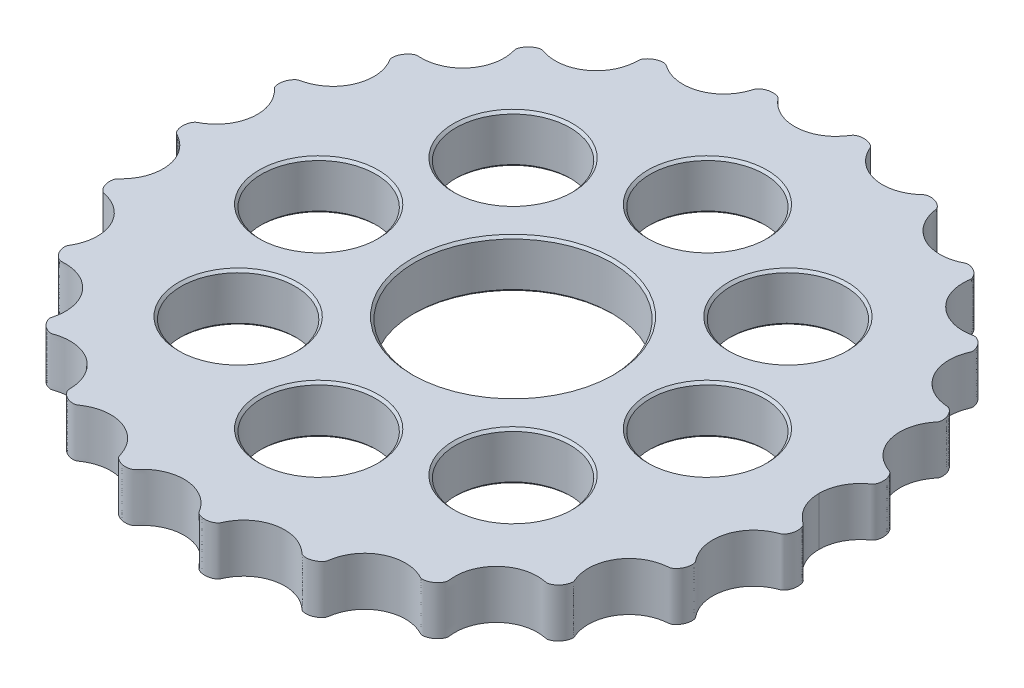
from build123d import *

# Parameters (mm, degrees)
BOSS_EXTRUDE2_DEPTH          = 4
SKETCH4_R                    = 8.1
CUT_EXTRUDE3_DEPTH           = 39.631779925
CHAMFER3_SIZE                = 0.2
SKETCH5_R                    = 4.7
CUT_EXTRUDE4_DEPTH           = 39.631779925
CHAMFER4_SIZE                = 0.2
CIRPATTERN2_COUNT            = 8
CHAMFER4_OF_CIRPATTERN2_SIZE = 0.2


with BuildPart() as part:
    # Boss-Extrude2: read off the stored shape, not the designer's step
    # Boss-Extrude2 outline → Boss-Extrude2 (new body)
    with BuildSketch(Plane(origin=(0, 0, 0), x_dir=(1, 0, 0), z_dir=(0, 1, 0))):
        with BuildLine():
            add(Edge.make_bspline(
                [(-27.2, -5.8e-08), (-27.199999999, -0.019133198), (-27.199133078, -0.057414725), (-27.195230703, -0.135465489), (-27.184807139, -0.211606055), (-27.166047725, -0.317535919), (-27.1349332, -0.429637697), (-27.091322319, -0.544583371), (-27.033663095, -0.652443367), (-26.975857569, -0.733258599), (-26.924878158, -0.790098396), (-26.85236248, -0.828146861), (-26.765832876, -0.877662664), (-26.653610001, -0.940819982), (-26.520769432, -1.023294126), (-26.379460109, -1.118575559), (-26.243541467, -1.220153984), (-26.112815998, -1.327504856), (-25.956815793, -1.468850425), (-25.779030612, -1.652001201), (-25.588219714, -1.884370565), (-25.39581381, -2.174101422), (-25.232178371, -2.486707055), (-25.077886955, -2.876099546), (-24.958985718, -3.349713644), (-24.910568474, -3.899287927), (-24.961634909, -4.436621669), (-25.07457138, -4.884978252), (-25.210781376, -5.239398914), (-25.3276905, -5.47778769), (-25.441338131, -5.672119707), (-25.543827079, -5.827030815), (-25.631803755, -5.947926268), (-25.724673074, -6.066389993), (-25.823842053, -6.180410635), (-25.910396853, -6.276707585), (-25.987352438, -6.351151536), (-26.044490633, -6.415067749), (-26.092464449, -6.45600624), (-26.148149594, -6.514552868), (-26.194742233, -6.621546796), (-26.230737515, -6.753942005), (-26.246736581, -6.913621726), (-26.241123125, -7.116681647), (-26.200480651, -7.341945139), (-26.124592781, -7.549062612), (-26.018035516, -7.731798337), (-25.908629577, -7.868961888), (-25.83151017, -7.942653437), (-25.763973317, -7.994708314), (-25.707824804, -8.022972123), (-25.679470972, -8.031842631), (-25.639908355, -8.041546861), (-25.589515371, -8.052677101), (-25.511041609, -8.072589283), (-25.404063123, -8.099565023), (-25.280287279, -8.134973629), (-25.104529367, -8.191921939), (-24.89680419, -8.271617077), (-24.660435134, -8.381527642), (-24.40130618, -8.530284177), (-24.154075981, -8.702420835), (-23.921178729, -8.897438935), (-23.648160332, -9.171461595), (-23.357579614, -9.545571582), (-23.086909105, -10.037086429), (-22.890864249, -10.644457773), (-22.822171233, -11.200115629), (-22.83820931, -11.677409754), (-22.899462682, -12.065810534), (-22.978110571, -12.37473042), (-23.068277813, -12.629470629), (-23.156573516, -12.832643057), (-23.233562226, -12.988559431), (-23.285354738, -13.086212132), (-23.32769556, -13.162049812), (-23.358689891, -13.217069346), (-23.381507202, -13.258136052), (-23.406670608, -13.29804194), (-23.425113283, -13.357547237), (-23.433717747, -13.434580828), (-23.436059793, -13.53454811), (-23.423191253, -13.657405355), (-23.384676738, -13.83270161), (-23.297377573, -14.052902726), (-23.173479148, -14.250202012), (-23.018849262, -14.419355844), (-22.882423501, -14.527841296), (-22.779755067, -14.593323155), (-22.687416154, -14.634714297), (-22.608621564, -14.663240416), (-22.532336694, -14.66186154), (-22.464064965, -14.657970826), (-22.391580535, -14.656086169), (-22.315385272, -14.654138828), (-22.220165909, -14.653477794), (-22.105845044, -14.655165733), (-21.933543936, -14.663343042), (-21.703951418, -14.68683955), (-21.436771712, -14.733876274), (-21.13585441, -14.815135911), (-20.840455355, -14.924655078), (-20.553491659, -15.062675785), (-20.207755347, -15.271289639), (-19.829605953, -15.571759834), (-19.451690105, -15.985580336), (-19.121972629, -16.522488437), (-18.927668303, -17.027839181), (-18.829211055, -17.476164511), (-18.791991341, -17.853504646), (-18.788981921, -18.159998252), (-18.809262438, -18.419503174), (-18.84014115, -18.631196598), (-18.871792288, -18.794093532), (-18.893707642, -18.894966449), (-18.915505759, -18.980874841), (-18.931075876, -19.051982982), (-18.947901611, -19.107372763), (-18.954062875, -19.170820488), (-18.943078235, -19.240288438), (-18.924025051, -19.327408787), (-18.886701234, -19.430785272), (-18.815263952, -19.579961077), (-18.689011452, -19.763062789), (-18.529546377, -19.924564281), (-18.340630276, -20.057517125), (-18.182290152, -20.136177379), (-18.066460518, -20.178399905), (-17.968536727, -20.202644418), (-17.898795619, -20.212549096), (-17.84364737, -20.2156627), (-17.793454162, -20.213145524), (-17.743136497, -20.197210151), (-17.683681642, -20.177756445), (-17.61388666, -20.156085997), (-17.525786876, -20.128528284), (-17.418286307, -20.0980991), (-17.254892846, -20.056404914), (-16.95501287, -19.996611201), (-16.538675557, -19.955693958), (-16.00112496, -19.98218915), (-15.396099339, -20.123997765), (-14.812677592, -20.380133792), (-14.341437934, -20.706758581), (-13.981827655, -21.055991598), (-13.719839104, -21.390245599), (-13.53979047, -21.674527031), (-13.390289283, -21.971915381), (-13.286238799, -22.240809426), (-13.215891125, -22.476885141), (-13.169996904, -22.675012707), (-13.140874334, -22.833699578), (-13.118703006, -22.992379392), (-13.103635019, -23.150773266), (-13.095546098, -23.282189417), (-13.092493945, -23.386532965), (-13.089038065, -23.463253212), (-13.090424315, -23.513243694), (-13.074934477, -23.586740215), (-13.031117566, -23.677875366), (-12.963825271, -23.783935666), (-12.86119124, -23.900988328), (-12.742986195, -24.007310293), (-12.579895325, -24.121520152), (-12.402576926, -24.209890577), (-12.218984696, -24.269871728), (-12.048498563, -24.298215568), (-11.932124337, -24.304382185), (-11.836331176, -24.300138385), (-11.763415144, -24.288312725), (-11.687027062, -24.271319803), (-11.620988181, -24.224386523), (-11.547155689, -24.176866601), (-11.465099614, -24.122999491), (-11.370591212, -24.06474547), (-11.262550044, -24.001451539), (-11.106804169, -23.917556005), (-10.898188883, -23.819353065), (-10.645807902, -23.722189622), (-10.276844798, -23.616758409), (-9.816309632, -23.543086726), (-9.267413402, -23.539828019), (-8.635295247, -23.654647544), (-8.099049848, -23.86471981), (-7.66886369, -24.121482982), (-7.337822569, -24.385263094), (-7.09806284, -24.61883599), (-6.884838068, -24.871745046), (-6.69901355, -25.14068068), (-6.561679291, -25.385644979), (-6.462454566, -25.598293012), (-6.391492149, -25.774528342), (-6.348447481, -25.894329935), (-6.313848449, -25.99770764), (-6.289717996, -26.075594837), (-6.272760698, -26.126541704), (-6.258863328, -26.178235229), (-6.224719265, -26.242456394), (-6.156688332, -26.318820815), (-6.059008395, -26.404882396), (-5.893718118, -26.511209554), (-5.675048028, -26.606079822), (-5.4418816, -26.658092325), (-5.205010451, -26.666553872), (-5.030920697, -26.645219452), (-4.91654205, -26.618244261), (-4.825889434, -26.585936626), (-4.758596326, -26.554076886), (-4.701310073, -26.518631026), (-4.66388201, -26.472615776), (-4.617247571, -26.419913995), (-4.563156132, -26.35736677), (-4.49881391, -26.285734931), (-4.415356267, -26.19688573), (-4.320872504, -26.10241462), (-4.185555254, -25.976712199), (-4.003412827, -25.826060224), (-3.777904261, -25.666242736), (-3.438718175, -25.469797984), (-3.00025539, -25.283030726), (-2.456697225, -25.1464052), (-1.811217889, -25.109882833), (-1.163691188, -25.199409324), (-0.624802578, -25.384578627), (-0.196649277, -25.613669517), (0.127465909, -25.843399722), (0.365025453, -26.046782245), (0.552943314, -26.239326417), (0.698532344, -26.411243752), (0.809429266, -26.556968603), (0.880797006, -26.657723218), (0.939693298, -26.745579213), (0.983018656, -26.811854011), (1.011889922, -26.85557123), (1.0395542, -26.900013631), (1.078345264, -26.94055319), (1.135568041, -26.979658579), (1.219592815, -27.02789574), (1.327974533, -27.072692378), (1.496010267, -27.121750548), (1.728424506, -27.150236986), (1.962611636, -27.136101197), (2.190194928, -27.079585301), (2.351969604, -27.010876659), (2.454840066, -26.953007153), (2.533688841, -26.895900708), (2.584895449, -26.850372233), (2.62171053, -26.808968546), (2.64524478, -26.76452663), (2.665782902, -26.718378658), (2.699039113, -26.65033022), (2.742433701, -26.558724873), (2.796394926, -26.453597394), (2.883533195, -26.295151603), (3.002933339, -26.102488482), (3.162909413, -25.881029118), (3.372982259, -25.640178522), (3.659114137, -25.36796782), (4.044711701, -25.082682583), (4.543417912, -24.823347956), (5.160557484, -24.639572546), (5.804190402, -24.577228491), (6.361235413, -24.629618796), (6.820197055, -24.7468534), (7.180218364, -24.887232731), (7.452476185, -25.022228636), (7.674347709, -25.157295039), (7.850535459, -25.281419164), (7.986991801, -25.387855166), (8.075084157, -25.460712515), (8.148905246, -25.52525041), (8.204458647, -25.572814945), (8.2402695, -25.605775958), (8.278382908, -25.635134892), (8.327055973, -25.657418062), (8.390484742, -25.678350459), (8.483570505, -25.699076769), (8.599095622, -25.711408859), (8.771449182, -25.710805412), (9.00232799, -25.673785619), (9.223302976, -25.59486344), (9.426876478, -25.477031327), (9.564958464, -25.36298995), (9.649372937, -25.276716289), (9.70701868, -25.1981895), (9.748697398, -25.133843502), (9.768430295, -25.066120088), (9.775777307, -25.001315327), (9.792835497, -24.918095823), (9.809245242, -24.813749212), (9.835501529, -24.693642827), (9.878848292, -24.51143358), (9.946347693, -24.287270871), (10.046444237, -24.024378406), (10.19206868, -23.729991019), (10.406692405, -23.383605305), (10.719642961, -22.998615805), (11.154332181, -22.613406477), (11.724097328, -22.280768853), (12.268835026, -22.093053323), (12.744642468, -22.010498453), (13.137075936, -21.992087242), (13.445028475, -22.005696268), (13.747746711, -22.046557228), (14.006316982, -22.104694797), (14.223188655, -22.170215357), (14.390065703, -22.230335278), (14.509885677, -22.279037925), (14.618582787, -22.325532416), (14.716359705, -22.372679206), (14.803173962, -22.411561304), (14.878382664, -22.452760952), (14.95968466, -22.460471913), (15.036057996, -22.462109616), (15.135875894, -22.452772264), (15.256436488, -22.428517485), (15.425109993, -22.37394062), (15.632106425, -22.269768199), (15.814129425, -22.132636958), (15.965931182, -21.969333295), (16.059115396, -21.831474223), (16.111365519, -21.733844424), (16.14383144, -21.650409895), (16.163682031, -21.58425453), (16.170950954, -21.521351267), (16.161688435, -21.464159075), (16.155860088, -21.389076426), (16.145038284, -21.295424212), (16.136692107, -21.186115641), (16.127498168, -21.017536268), (16.126269084, -20.80526027), (16.141510864, -20.548473986), (16.185318357, -20.249577003), (16.255883937, -19.952429431), (16.354008813, -19.659668157), (16.512399064, -19.299966466), (16.754655955, -18.895634421), (17.107232223, -18.473068057), (17.588260553, -18.076850807), (18.059925697, -17.815170005), (18.492639869, -17.654850785), (18.861232174, -17.566562604), (19.123599394, -17.527952619), (19.348018577, -17.511424217), (19.533651718, -17.508184382), (19.683012998, -17.511857017), (19.832842468, -17.521605481), (19.982859323, -17.537526577), (20.106884249, -17.554993484), (20.205088076, -17.571626575), (20.278033953, -17.584026137), (20.325615032, -17.592332845), (20.371290172, -17.601212733), (20.415459767, -17.599877742), (20.466730737, -17.59076029), (20.534155398, -17.573715385), (20.618294528, -17.542661823), (20.723767019, -17.490758414), (20.838111044, -17.417571118), (20.979828886, -17.303526123), (21.109507981, -17.163723096), (21.218157865, -17.007247314), (21.298783601, -16.845400046), (21.344353419, -16.720719826), (21.372673835, -16.609254476), (21.385074169, -16.513807755), (21.388802808, -16.429060026), (21.378097961, -16.35695084), (21.346028453, -16.292682934), (21.324477519, -16.227447162), (21.289690418, -16.144823584), (21.252680096, -16.042010872), (21.211276942, -15.921226904), (21.158712582, -15.744380248), (21.106242449, -15.527406409), (21.062847691, -15.269403782), (21.038730924, -14.970461144), (21.041419009, -14.591737623), (21.099514779, -14.133182412), (21.249130997, -13.610610307), (21.528443052, -13.052208973), (21.903282747, -12.558539383), (22.300819587, -12.196099867), (22.745297615, -11.8993405), (23.157019367, -11.705191301), (23.4800956, -11.597229767), (23.771423328, -11.5307645), (23.933059675, -11.502466075), (24.037729575, -11.487462758), (24.125096623, -11.476082347), (24.195306497, -11.469412342), (24.260843892, -11.461701639), (24.321910644, -11.456216455), (24.387015964, -11.449232346), (24.449668291, -11.419362265), (24.52302427, -11.376799829), (24.604172718, -11.314759519), (24.718572535, -11.207868672), (24.850036792, -11.040948052), (24.954704179, -10.846246939), (25.02610642, -10.628861387), (25.056825067, -10.450622479), (25.06465956, -10.317676292), (25.059036844, -10.204871957), (25.043965515, -10.113836967), (25.025248118, -10.04463421), (25.004912469, -9.99802351), (24.976064244, -9.959056605), (24.938238258, -9.910582847), (24.895170115, -9.852676713), (24.845066465, -9.786345637), (24.784234874, -9.701138925), (24.721590619, -9.609512939), (24.651926212, -9.500340335), (24.557345086, -9.338410822), (24.453849457, -9.13621637), (24.321673023, -8.824386079), (24.19360824, -8.386114996), (24.120926778, -7.852419469), (24.150120672, -7.225330595), (24.300722879, -6.597919091), (24.571250126, -6.006926265), (24.906002732, -5.541138338), (25.250263613, -5.195203354), (25.565693114, -4.948936314), (25.801983018, -4.797384567), (26.011688287, -4.683777206), (26.173073138, -4.60767808), (26.284218182, -4.559219437), (26.380146848, -4.521095335), (26.448944327, -4.491508361), (26.509506384, -4.471271375), (26.579578657, -4.440383108), (26.640996169, -4.384242444), (26.70672435, -4.310831751), (26.801461685, -4.170405785), (26.893463025, -3.973793652), (26.950808441, -3.749748192), (26.966774836, -3.507070545), (26.949648435, -3.317402376), (26.921678715, -3.18241347), (26.885878155, -3.073525585), (26.848407268, -2.990285719), (26.812121046, -2.928551983), (26.780884093, -2.886598489), (26.740177345, -2.853320754), (26.697457873, -2.82223908), (26.648413979, -2.785010881), (26.576072871, -2.729479125), (26.488328946, -2.660050157), (26.386835419, -2.574575111), (26.273360152, -2.471280002), (26.163378128, -2.362477632), (26.057289551, -2.24796738), (25.955568553, -2.128066416), (25.858626822, -2.002301231), (25.701843205, -1.779060884), (25.565451422, -1.540480889), (25.451334792, -1.291744247), (25.360817709, -1.031127703), (25.31516078, -0.879403726), (25.276834441, -0.718665774), (25.245978754, -0.568295348), (25.222714357, -0.395119689), (25.207145033, -0.256635565), (25.201299171, -0.107230742), (25.200000036, -0.035922583), (25.2, -3.334e-06)],
                knots=[0.046454864, 0.046454864, 0.046454864, 0.046454864, 0.046454864, 0.047232469, 0.048010073, 0.048787678, 0.049565282, 0.050938566, 0.05231185, 0.05315329, 0.053994729, 0.054515303, 0.055035878, 0.056077026, 0.057614054, 0.059151082, 0.060688109, 0.062225137, 0.063740528, 0.065255919, 0.068286701, 0.071433014, 0.074579326, 0.077791817, 0.081004308, 0.086528383, 0.092148952, 0.097600605, 0.100385791, 0.103170977, 0.105840314, 0.107174982, 0.10850965, 0.109874755, 0.11123986, 0.112604965, 0.11397007, 0.114541538, 0.115113005, 0.115684473, 0.11625594, 0.117421822, 0.11927225, 0.120640687, 0.122009125, 0.124752137, 0.127492464, 0.12855148, 0.129610496, 0.131071512, 0.131339425, 0.131607339, 0.131875252, 0.132143166, 0.132807096, 0.133471025, 0.134798885, 0.136126745, 0.137454604, 0.140140904, 0.142827204, 0.145528371, 0.148229538, 0.151005085, 0.153780633, 0.159476507, 0.165276509, 0.171144386, 0.176683858, 0.179574119, 0.18246438, 0.185321259, 0.188178138, 0.189318444, 0.19045875, 0.191599057, 0.19216921, 0.192454287, 0.192739363, 0.193297943, 0.193856523, 0.194689634, 0.195522744, 0.19691039, 0.198298035, 0.20116106, 0.204021251, 0.205269796, 0.206518341, 0.207453746, 0.208389152, 0.20894087, 0.209492588, 0.210180452, 0.210868316, 0.21155618, 0.212244045, 0.213619773, 0.214995501, 0.217783514, 0.220571528, 0.223403098, 0.226234669, 0.229143498, 0.232052327, 0.23796145, 0.243610948, 0.249256343, 0.254671638, 0.257403099, 0.260134561, 0.262929671, 0.26572478, 0.266790025, 0.26785527, 0.268920515, 0.269453137, 0.269985759, 0.270490915, 0.270996071, 0.271746348, 0.272496624, 0.27372076, 0.274944896, 0.277712789, 0.28048076, 0.281861751, 0.283242742, 0.28408284, 0.284922937, 0.285497224, 0.285784367, 0.28607151, 0.286730628, 0.287389746, 0.288048864, 0.288707982, 0.290065233, 0.291422485, 0.294136988, 0.299742208, 0.305126441, 0.310752266, 0.316453804, 0.322615531, 0.325697654, 0.328779776, 0.331762651, 0.334745525, 0.337697862, 0.33917403, 0.340650198, 0.34208599, 0.343521782, 0.344957575, 0.346393367, 0.34684075, 0.347288133, 0.347735516, 0.3481829, 0.349540401, 0.350905748, 0.352271095, 0.353773536, 0.355275978, 0.35807282, 0.359393936, 0.360715051, 0.361497571, 0.362280092, 0.362838678, 0.363397265, 0.364278124, 0.365158983, 0.366039841, 0.3669207, 0.368297581, 0.369674462, 0.372428225, 0.375239429, 0.378050634, 0.383511041, 0.389216454, 0.394947945, 0.401111676, 0.404172852, 0.407234029, 0.410206124, 0.41317822, 0.416098901, 0.419019582, 0.420332349, 0.421645117, 0.422957885, 0.423614269, 0.424270653, 0.424586257, 0.424901862, 0.425533072, 0.426883808, 0.428243238, 0.429602668, 0.432595813, 0.435453384, 0.436789163, 0.438124941, 0.43890833, 0.439691719, 0.440253953, 0.440816186, 0.441313139, 0.441810092, 0.442803998, 0.443797904, 0.444791809, 0.446210021, 0.447628233, 0.450464657, 0.4533206, 0.456176544, 0.461761291, 0.467617147, 0.473438391, 0.479376925, 0.485216446, 0.488063509, 0.490910571, 0.493701665, 0.496492758, 0.497766155, 0.499039552, 0.500312949, 0.500949648, 0.501586346, 0.50189722, 0.502208094, 0.502829841, 0.503604268, 0.504378695, 0.505712099, 0.507045503, 0.509915607, 0.512782554, 0.514123557, 0.51546456, 0.516248863, 0.517033167, 0.517634076, 0.517934531, 0.518234986, 0.518844574, 0.519454162, 0.520673337, 0.521892513, 0.523111689, 0.525982103, 0.528852518, 0.531743848, 0.534635178, 0.540221342, 0.546114964, 0.551919501, 0.557741901, 0.563427302, 0.566197215, 0.568967128, 0.571676508, 0.574385887, 0.575565318, 0.576744749, 0.57792418, 0.578513896, 0.579103611, 0.579389859, 0.579676106, 0.580248601, 0.581023253, 0.581797906, 0.583115079, 0.584432252, 0.58723539, 0.590192252, 0.591530449, 0.592868646, 0.593696604, 0.594524561, 0.595061397, 0.595598234, 0.596232646, 0.596867058, 0.598135881, 0.599404705, 0.600673529, 0.603628091, 0.606582653, 0.609548325, 0.612513997, 0.618319571, 0.62443328, 0.630386103, 0.636179067, 0.638994433, 0.641809799, 0.644551946, 0.647294092, 0.650009901, 0.651367806, 0.65272571, 0.653699775, 0.65467384, 0.655647906, 0.656621971, 0.657168634, 0.657715297, 0.658553639, 0.65939198, 0.660772137, 0.662152294, 0.664935947, 0.66771994, 0.668940792, 0.670161643, 0.670933623, 0.671705603, 0.672174044, 0.672642485, 0.673208384, 0.673774283, 0.67490608, 0.676037878, 0.677169675, 0.679868508, 0.68256734, 0.685315467, 0.688063594, 0.690882188, 0.693700781, 0.699487072, 0.705024207, 0.710638272, 0.716076702, 0.718855775, 0.721634848, 0.72430507, 0.725640181, 0.726975292, 0.728336867, 0.729698441, 0.731060016, 0.73242159, 0.732858304, 0.733295019, 0.733731733, 0.734168447, 0.734527276, 0.734886104, 0.735603762, 0.736679875, 0.737755988, 0.739124732, 0.740493476, 0.743236832, 0.744607226, 0.745977619, 0.747002686, 0.748027753, 0.748742486, 0.749457219, 0.750047935, 0.750638651, 0.751296931, 0.751955211, 0.753271771, 0.754588331, 0.755904891, 0.758615856, 0.76132682, 0.764023677, 0.766720534, 0.772273833, 0.777963976, 0.78353911, 0.789135136, 0.794529173, 0.797282477, 0.802778105, 0.805520427, 0.806793032, 0.808065636, 0.808701938, 0.809338241, 0.809974543, 0.810610845, 0.811084403, 0.811557961, 0.812319576, 0.81308119, 0.814155534, 0.815229878, 0.817967101, 0.820711296, 0.822082278, 0.823453259, 0.824482807, 0.825512355, 0.826148014, 0.826783673, 0.827060971, 0.827338269, 0.827892864, 0.829002055, 0.829669931, 0.830337807, 0.831673558, 0.83300931, 0.834345061, 0.837107327, 0.839869593, 0.845222841, 0.850783138, 0.856452013, 0.862408244, 0.868377936, 0.874101439, 0.877036047, 0.879970655, 0.882806118, 0.884223849, 0.88564158, 0.886412194, 0.887182807, 0.887953421, 0.888338728, 0.888724035, 0.88992562, 0.890915013, 0.891904406, 0.894816656, 0.897729019, 0.899188273, 0.900647527, 0.901672688, 0.90269785, 0.903317668, 0.903937486, 0.904255322, 0.904573157, 0.905208828, 0.905844498, 0.906480169, 0.907864894, 0.909249618, 0.910634343, 0.912019068, 0.913450591, 0.914882113, 0.916313636, 0.917745158, 0.923308634, 0.924758084, 0.926207534, 0.927656985, 0.929106435, 0.930566256, 0.932026077, 0.933485899, 0.934945754, 0.934945754, 0.934945754, 0.934945754, 0.934945754], degree=4))
            add(Edge.make_bspline(
                [(25.2, -3.334e-06), (25.200000038, 0.035919249), (25.201299178, 0.107227408), (25.207145049, 0.256632231), (25.222714382, 0.395116354), (25.245978789, 0.568292011), (25.276834486, 0.718662435), (25.315160835, 0.879400385), (25.360817773, 1.031124359), (25.451334873, 1.291740897), (25.565451518, 1.540477532), (25.701843316, 1.779057519), (25.858626947, 2.002297856), (25.955568686, 2.128063035), (26.057289691, 2.247963993), (26.163378276, 2.362474238), (26.273360306, 2.471276601), (26.38683558, 2.574571703), (26.488329112, 2.660046743), (26.576073042, 2.729475705), (26.648414153, 2.785007456), (26.697458049, 2.822235652), (26.740177523, 2.853317324), (26.780884273, 2.886595057), (26.812121229, 2.928548548), (26.848407455, 2.990282282), (26.885878347, 3.073522146), (26.921678914, 3.182410028), (26.949648643, 3.317398933), (26.966775055, 3.5070671), (26.950808676, 3.749744748), (26.893463274, 3.973790212), (26.801461946, 4.170402351), (26.70672462, 4.310828323), (26.640996443, 4.38423902), (26.579578934, 4.440379688), (26.509506664, 4.471267959), (26.448944608, 4.491504949), (26.380147131, 4.521091927), (26.284218467, 4.559216035), (26.173073426, 4.607674685), (26.01168858, 4.683773821), (25.801983318, 4.797381196), (25.565693424, 4.948932957), (25.250263938, 5.195200017), (24.906003078, 5.541135022), (24.571250502, 6.00692297), (24.300723291, 6.597915813), (24.150121123, 7.225327327), (24.120927269, 7.852416202), (24.193608765, 8.386111725), (24.321673575, 8.8243828), (24.453850028, 9.136213082), (24.55734567, 9.338407528), (24.651926806, 9.500337035), (24.72159122, 9.609509635), (24.78423548, 9.701135617), (24.845067077, 9.786342325), (24.895170731, 9.852673398), (24.938238878, 9.910579529), (24.976064866, 9.959053285), (25.004913094, 9.998020188), (25.025248746, 10.044630887), (25.043966147, 10.113833643), (25.059037481, 10.204868632), (25.064660205, 10.317672967), (25.05682572, 10.450619154), (25.026107085, 10.628858064), (24.954704857, 10.84624362), (24.850037483, 11.04094474), (24.718573236, 11.207865368), (24.604173426, 11.314756222), (24.523024981, 11.376796537), (24.449669005, 11.419358978), (24.38701668, 11.449229063), (24.32191136, 11.456213176), (24.260844609, 11.461698364), (24.195307214, 11.469409071), (24.12509734, 11.47607908), (24.037730293, 11.487459497), (23.933060394, 11.50246282), (23.771424049, 11.530761255), (23.480096325, 11.59722654), (23.157020099, 11.705188094), (22.745298359, 11.89933732), (22.30082035, 12.196096715), (21.903283532, 12.558536255), (21.528443868, 13.052205869), (21.249131848, 13.61060722), (21.099515662, 14.133179335), (21.041419921, 14.591734549), (21.03873186, 14.97045807), (21.062848646, 15.269400707), (21.10624342, 15.527403331), (21.158713566, 15.744377167), (21.211277938, 15.921223819), (21.252681099, 16.042007785), (21.289691428, 16.144820495), (21.324478534, 16.22744407), (21.346029471, 16.292679841), (21.378098984, 16.356947745), (21.388803835, 16.429056931), (21.385075202, 16.51380466), (21.372674873, 16.609251381), (21.344354465, 16.720716733), (21.298784654, 16.845396956), (21.218158929, 17.007244229), (21.109509054, 17.163720018), (20.979829968, 17.303523053), (20.838112133, 17.417568057), (20.723768112, 17.49075536), (20.618295625, 17.542658776), (20.534156497, 17.573712343), (20.466731837, 17.590757252), (20.415460867, 17.599874707), (20.371291273, 17.601209701), (20.325616132, 17.592329816), (20.278035053, 17.584023111), (20.205089174, 17.571623553), (20.106885347, 17.554990468), (19.98286042, 17.537523569), (19.832843563, 17.521602482), (19.683014092, 17.511854027), (19.533652812, 17.508181402), (19.348019672, 17.511421249), (19.123600489, 17.527949665), (18.861233272, 17.566559666), (18.492640973, 17.65484787), (18.05992681, 17.815167118), (17.588261683, 18.076847949), (17.107233378, 18.473065229), (16.754657137, 18.895631615), (16.51240027, 19.299963675), (16.354010042, 19.659665376), (16.255885184, 19.952426656), (16.185319623, 20.249574232), (16.141512148, 20.548471219), (16.126270385, 20.805257503), (16.127499482, 21.017533501), (16.136693432, 21.186112873), (16.145039616, 21.295421444), (16.155861425, 21.389073657), (16.161689777, 21.464156306), (16.170952299, 21.521348497), (16.16368338, 21.584251761), (16.143832794, 21.650407127), (16.111366878, 21.733841658), (16.059116761, 21.83147146), (15.965932556, 21.969330538), (15.814130809, 22.132634211), (15.632107817, 22.269765463), (15.425111392, 22.373937897), (15.256437891, 22.428514772), (15.135877297, 22.452769559), (15.036059401, 22.462106918), (14.959686065, 22.460469219), (14.878384067, 22.452758263), (14.803175363, 22.41155862), (14.716361104, 22.372676527), (14.618584182, 22.325529744), (14.50988707, 22.27903526), (14.390067093, 22.23033262), (14.223190041, 22.170212709), (14.006318364, 22.104692162), (13.74774809, 22.04655461), (13.445029851, 22.005693669), (13.137077311, 21.992084662), (12.744643844, 22.010495898), (12.268836407, 22.093050797), (11.724098721, 22.280766361), (11.154333595, 22.613404021), (10.719644399, 22.998613376), (10.406693867, 23.383602896), (10.192070164, 23.729988623), (10.046445739, 24.024376019), (9.946349211, 24.287268491), (9.878849825, 24.511431204), (9.835503073, 24.693640453), (9.809246793, 24.813746841), (9.792837055, 24.918093453), (9.77577887, 25.001312957), (9.768431862, 25.066117719), (9.748698969, 25.133841134), (9.707020255, 25.198187135), (9.649374517, 25.276713927), (9.564960049, 25.362987594), (9.426878071, 25.47702898), (9.223304576, 25.594861105), (9.002329595, 25.673783298), (8.77145079, 25.710803105), (8.599097229, 25.711406563), (8.483572112, 25.69907448), (8.390486348, 25.678348176), (8.327057577, 25.657415783), (8.278384511, 25.635132616), (8.240271101, 25.605773684), (8.204460246, 25.572812674), (8.148906842, 25.525248142), (8.075085749, 25.460710252), (7.986993389, 25.387852908), (7.85053704, 25.281416915), (7.674349281, 25.157292801), (7.45247775, 25.022226411), (7.18021992, 24.887230523), (6.820198602, 24.746851215), (6.361236953, 24.629616639), (5.804191939, 24.577226369), (5.160559024, 24.639570465), (4.543419464, 24.823345913), (4.044713269, 25.082680571), (3.659115723, 25.367965833), (3.372983862, 25.640176552), (3.162911031, 25.881027162), (3.002934971, 26.102486536), (2.883534839, 26.295149664), (2.79639658, 26.45359546), (2.742435361, 26.558722943), (2.69904078, 26.650328293), (2.665784572, 26.718376733), (2.645246454, 26.764524706), (2.621712207, 26.808966624), (2.584897127, 26.850370313), (2.533690523, 26.895898791), (2.454841751, 26.953005241), (2.351971293, 27.010874753), (2.190196621, 27.079583406), (1.962613332, 27.136099316), (1.728426204, 27.150235119), (1.496011963, 27.121748696), (1.327976225, 27.072690536), (1.219594504, 27.027893906), (1.135569728, 26.97965675), (1.078346948, 26.940551364), (1.039555882, 26.900011808), (1.011891601, 26.855569408), (0.983020332, 26.811852191), (0.93969497, 26.745577395), (0.880798673, 26.657721404), (0.809430927, 26.556966794), (0.698533995, 26.41124195), (0.552944954, 26.239324624), (0.365027082, 26.046780464), (0.127467525, 25.843397955), (-0.196647676, 25.613667771), (-0.624800991, 25.384576907), (-1.163689612, 25.199407639), (-1.811216319, 25.109881188), (-2.456695652, 25.146403595), (-3.000253809, 25.283029155), (-3.438716583, 25.469796441), (-3.777902657, 25.666241214), (-4.003411212, 25.826058716), (-4.18555363, 25.976710703), (-4.320870873, 26.102413131), (-4.415354629, 26.196884247), (-4.498812267, 26.285733454), (-4.563154485, 26.357365296), (-4.617245919, 26.419912525), (-4.663880355, 26.472614309), (-4.701308415, 26.518629562), (-4.758594666, 26.554075425), (-4.825887772, 26.585935169), (-4.916540386, 26.61824281), (-5.030919031, 26.645218008), (-5.205008784, 26.666552439), (-5.441879933, 26.658090906), (-5.675046365, 26.606078418), (-5.89371646, 26.511208164), (-6.059006744, 26.404881016), (-6.156686687, 26.318819442), (-6.224717624, 26.242455025), (-6.258861691, 26.178233862), (-6.272759065, 26.126540337), (-6.289716366, 26.075593472), (-6.313846824, 25.997706277), (-6.348445863, 25.894328573), (-6.391490537, 25.774526983), (-6.462452965, 25.598291657), (-6.561677704, 25.385643631), (-6.699011978, 25.14067934), (-6.884836513, 24.871743718), (-7.098061301, 24.618834675), (-7.337821045, 24.385261794), (-7.668862182, 24.121481703), (-8.099048356, 23.864718558), (-8.635293768, 23.654646325), (-9.26741193, 23.53982684), (-9.816308161, 23.543085581), (-10.276843322, 23.616757293), (-10.645806419, 23.722188529), (-10.898187394, 23.819351988), (-11.106802674, 23.917554941), (-11.262548544, 24.001450485), (-11.370589707, 24.064744422), (-11.465098106, 24.122998449), (-11.547154177, 24.176865564), (-11.620986667, 24.224385491), (-11.687025544, 24.271318775), (-11.763413626, 24.288311702), (-11.836329657, 24.300137366), (-11.932122818, 24.304381173), (-12.048497044, 24.298214563), (-12.218983179, 24.269870734), (-12.402575413, 24.209889594), (-12.579893817, 24.12151918), (-12.742984694, 24.007309332), (-12.861189745, 23.900987374), (-12.963823784, 23.783934718), (-13.031116086, 23.677874422), (-13.074933002, 23.586739274), (-13.090422845, 23.513242754), (-13.089036598, 23.463252272), (-13.092492483, 23.386532025), (-13.095544643, 23.282188477), (-13.103633572, 23.150772327), (-13.118701569, 22.992378454), (-13.140872907, 22.833698641), (-13.169995486, 22.675011772), (-13.21588972, 22.476884209), (-13.286237409, 22.240808498), (-13.390287909, 21.971914459), (-13.539789115, 21.674526119), (-13.719837767, 21.390244698), (-13.981826339, 21.055990714), (-14.341436639, 20.706757719), (-14.812676318, 20.380132959), (-15.396098081, 20.123996969), (-16.001123711, 19.982188392), (-16.538674309, 19.955693234), (-16.95501162, 19.996610503), (-17.254891592, 20.056404235), (-17.41828505, 20.09809843), (-17.525785617, 20.128527621), (-17.6138854, 20.15608534), (-17.68368038, 20.177755792), (-17.743135234, 20.197209502), (-17.793452898, 20.213144878), (-17.843646106, 20.215662057), (-17.898794356, 20.212548456), (-17.968535464, 20.202643782), (-18.066459257, 20.178399276), (-18.182288894, 20.136176757), (-18.340629022, 20.057516513), (-18.529545132, 19.924563681), (-18.689010217, 19.763062199), (-18.815262728, 19.579960495), (-18.886700019, 19.430784694), (-18.924023843, 19.327408211), (-18.943077032, 19.240287864), (-18.954061676, 19.170819915), (-18.947900416, 19.107372189), (-18.931074685, 19.051982407), (-18.915504572, 18.980874265), (-18.893706461, 18.894965872), (-18.871791113, 18.794092953), (-18.840139985, 18.631196017), (-18.809261287, 18.419502592), (-18.788980786, 18.159997668), (-18.791990225, 17.853504062), (-18.829209962, 17.47616393), (-18.927667238, 17.027838606), (-19.121971596, 16.522487874), (-19.451689106, 15.985579793), (-19.829604979, 15.571759315), (-20.207754392, 15.271289143), (-20.553490718, 15.062675311), (-20.840454422, 14.924654622), (-21.135853484, 14.815135474), (-21.436770791, 14.733875856), (-21.7039505, 14.686839149), (-21.933543019, 14.663342655), (-22.105844128, 14.655165357), (-22.220164993, 14.653477425), (-22.315384356, 14.654138465), (-22.391579618, 14.656085811), (-22.464064048, 14.657970471), (-22.532335777, 14.66186119), (-22.608620647, 14.663240071), (-22.687415239, 14.634713957), (-22.779754155, 14.593322821), (-22.882422593, 14.527840968), (-23.01884836, 14.419355525), (-23.173478257, 14.250201702), (-23.297376694, 14.052902424), (-23.384675873, 13.832701314), (-23.4231904, 13.657405061), (-23.436058947, 13.534547816), (-23.433716907, 13.434580535), (-23.425112448, 13.357546943), (-23.406669777, 13.298041645), (-23.381506373, 13.258135755), (-23.358689064, 13.217069048), (-23.327694737, 13.162049512), (-23.28535392, 13.086211829), (-23.233561414, 12.988559125), (-23.156572713, 12.832642746), (-23.068277023, 12.629470313), (-22.978109798, 12.374730098), (-22.899461928, 12.065810207), (-22.83820858, 11.677409423), (-22.822170533, 11.200115298), (-22.890863584, 10.644457445), (-23.086908478, 10.037086114), (-23.357579017, 9.545571284), (-23.648159758, 9.171461315), (-23.921178173, 8.897438672), (-24.154075437, 8.702420587), (-24.401305647, 8.530283944), (-24.66043461, 8.381527425), (-24.896803673, 8.271616875), (-25.104528855, 8.19192175), (-25.28028677, 8.134973451), (-25.404062616, 8.099564853), (-25.511041104, 8.072589119), (-25.589514867, 8.052676942), (-25.639907852, 8.041546705), (-25.679470469, 8.031842478), (-25.707824303, 8.022971972), (-25.763972817, 7.994708166), (-25.831509673, 7.942653293), (-25.908629085, 7.868961749), (-26.018035032, 7.731798205), (-26.124592309, 7.549062487), (-26.200480192, 7.341945018), (-26.24112268, 7.116681529), (-26.246736149, 6.913621608), (-26.230737093, 6.753941887), (-26.194741819, 6.621546675), (-26.148149187, 6.514552744), (-26.092464046, 6.456006113), (-26.044490232, 6.415067618), (-25.987352041, 6.351151402), (-25.91039646, 6.276707446), (-25.823841666, 6.180410491), (-25.724672695, 6.066389843), (-25.631803383, 5.947926112), (-25.543826715, 5.827030653), (-25.441337776, 5.67211954), (-25.327690157, 5.477787515), (-25.210781048, 5.239398732), (-25.074571075, 4.884978061), (-24.961634631, 4.436621471), (-24.910568231, 3.899287725), (-24.958985508, 3.349713446), (-25.077886775, 2.876099355), (-25.232178215, 2.486706874), (-25.395813674, 2.174101251), (-25.588219597, 1.884370406), (-25.779030509, 1.652001054), (-25.956815701, 1.46885029), (-26.112815915, 1.32750473), (-26.243541391, 1.220153866), (-26.379460039, 1.11857545), (-26.520769368, 1.023294026), (-26.653609943, 0.94081989), (-26.765832821, 0.877662578), (-26.852362428, 0.828146781), (-26.924878109, 0.790098321), (-26.975857523, 0.733258527), (-27.033663054, 0.652443299), (-27.091322285, 0.544583306), (-27.134933173, 0.429637635), (-27.166047705, 0.317535859), (-27.184807126, 0.211605996), (-27.195230695, 0.13546543), (-27.199133075, 0.057414667), (-27.199999998, 0.01913314), (-27.2, -5.8e-08)],
                knots=[0.046454864, 0.046454864, 0.046454864, 0.046454864, 0.046454864, 0.047914719, 0.049374541, 0.050834362, 0.052294183, 0.053743633, 0.055193084, 0.056642534, 0.058091984, 0.06365546, 0.065086982, 0.066518505, 0.067950027, 0.06938155, 0.070766275, 0.072151, 0.073535724, 0.074920449, 0.07555612, 0.07619179, 0.076827461, 0.077145296, 0.077463132, 0.07808295, 0.078702768, 0.07972793, 0.080753091, 0.082212345, 0.083671599, 0.086583962, 0.089496212, 0.090485605, 0.091474998, 0.092676584, 0.09306189, 0.093447197, 0.094217811, 0.094988424, 0.095759038, 0.097176769, 0.0985945, 0.101429963, 0.104364571, 0.107299179, 0.113022682, 0.118992374, 0.124948605, 0.13061748, 0.136177777, 0.141531025, 0.144293291, 0.147055557, 0.148391308, 0.14972706, 0.151062812, 0.151730687, 0.152398563, 0.153507754, 0.154062349, 0.154339647, 0.154616945, 0.155252604, 0.155888263, 0.156917811, 0.157947359, 0.15931834, 0.160689322, 0.163433517, 0.16617074, 0.167245084, 0.168319428, 0.169081042, 0.169842657, 0.170316215, 0.170789773, 0.171426075, 0.172062378, 0.17269868, 0.173334982, 0.174607586, 0.175880191, 0.178622513, 0.184118141, 0.186871445, 0.192265482, 0.197861508, 0.203436642, 0.209126785, 0.214680084, 0.217376941, 0.220073798, 0.222784762, 0.225495727, 0.226812287, 0.228128847, 0.229445407, 0.230103687, 0.230761967, 0.231352683, 0.231943399, 0.232658132, 0.233372865, 0.234397932, 0.235422999, 0.236793392, 0.238163786, 0.240907142, 0.242275886, 0.24364463, 0.244720743, 0.245796856, 0.246514514, 0.246873342, 0.247232171, 0.247668885, 0.248105599, 0.248542314, 0.248979028, 0.250340602, 0.251702177, 0.253063751, 0.254425326, 0.255760437, 0.257095548, 0.25976577, 0.262544843, 0.265323916, 0.270762346, 0.276376411, 0.281913546, 0.287699837, 0.290518431, 0.293337024, 0.296085151, 0.298833278, 0.30153211, 0.304230943, 0.30536274, 0.306494538, 0.307626335, 0.308192234, 0.308758133, 0.309226574, 0.309695015, 0.310466995, 0.311238975, 0.312459827, 0.313680678, 0.316464671, 0.319248324, 0.320628481, 0.322008638, 0.322846979, 0.323685321, 0.324231984, 0.324778647, 0.325752712, 0.326726778, 0.327700843, 0.328674908, 0.330032812, 0.331390717, 0.334106526, 0.336848672, 0.339590819, 0.342406185, 0.345221551, 0.351014515, 0.356967338, 0.363081047, 0.368886621, 0.371852293, 0.374817965, 0.377772527, 0.380727089, 0.381995913, 0.383264737, 0.384533561, 0.385167972, 0.385802384, 0.386339221, 0.386876057, 0.387704015, 0.388531972, 0.389870169, 0.391208366, 0.394165228, 0.396968366, 0.398285539, 0.399602712, 0.400377365, 0.401152017, 0.401724512, 0.402010759, 0.402297007, 0.402886722, 0.403476438, 0.404655869, 0.4058353, 0.407014731, 0.40972411, 0.41243349, 0.415203403, 0.417973316, 0.423658717, 0.429481117, 0.435285654, 0.441179276, 0.44676544, 0.44965677, 0.4525481, 0.455418515, 0.458288929, 0.459508105, 0.460727281, 0.461946456, 0.462556044, 0.463165632, 0.463466087, 0.463766542, 0.464367451, 0.465151755, 0.465936058, 0.467277061, 0.468618064, 0.471485011, 0.474355115, 0.475688519, 0.477021923, 0.47779635, 0.478570777, 0.479192525, 0.479503398, 0.479814272, 0.48045097, 0.481087669, 0.482361066, 0.483634463, 0.48490786, 0.487698953, 0.490490047, 0.493337109, 0.496184172, 0.502023693, 0.507962227, 0.513783471, 0.519639327, 0.525224075, 0.528080018, 0.530935961, 0.533772385, 0.535190597, 0.536608809, 0.537602714, 0.53859662, 0.539590526, 0.540087479, 0.540584432, 0.541146665, 0.541708899, 0.542492288, 0.543275677, 0.544611455, 0.545947234, 0.548804805, 0.55179795, 0.55315738, 0.55451681, 0.555867546, 0.556498756, 0.556814361, 0.557129965, 0.557786349, 0.558442733, 0.559755501, 0.561068269, 0.562381036, 0.565301717, 0.568222398, 0.571194494, 0.574166589, 0.577227766, 0.580288942, 0.586452673, 0.592184164, 0.597889577, 0.603349984, 0.606161189, 0.608972393, 0.611726156, 0.613103037, 0.614479918, 0.615360777, 0.616241635, 0.617122494, 0.618003353, 0.61856194, 0.619120526, 0.619903047, 0.620685567, 0.622006682, 0.623327798, 0.62612464, 0.627627082, 0.629129523, 0.63049487, 0.631860217, 0.633217718, 0.633665102, 0.634112485, 0.634559868, 0.635007251, 0.636443043, 0.637878836, 0.639314628, 0.64075042, 0.642226588, 0.643702756, 0.646655093, 0.649637967, 0.652620842, 0.655702964, 0.658785087, 0.664946814, 0.670648352, 0.676274177, 0.68165841, 0.68726363, 0.689978133, 0.691335385, 0.692692636, 0.693351754, 0.694010872, 0.69466999, 0.695329108, 0.695616251, 0.695903394, 0.696477681, 0.697317778, 0.698157876, 0.699538867, 0.700919858, 0.703687829, 0.706455722, 0.707679858, 0.708903994, 0.70965427, 0.710404547, 0.710909703, 0.711414859, 0.711947481, 0.712480103, 0.713545348, 0.714610593, 0.715675838, 0.718470947, 0.721266057, 0.723997519, 0.72672898, 0.732144275, 0.73778967, 0.743439168, 0.749348292, 0.75225712, 0.755165949, 0.75799752, 0.76082909, 0.763617104, 0.766405117, 0.767780845, 0.769156573, 0.769844438, 0.770532302, 0.771220166, 0.77190803, 0.772459748, 0.773011466, 0.773946872, 0.774882277, 0.776130822, 0.777379367, 0.780239558, 0.783102583, 0.784490228, 0.785877874, 0.786710984, 0.787544095, 0.788102675, 0.788661255, 0.788946331, 0.789231408, 0.789801561, 0.790941868, 0.792082174, 0.79322248, 0.796079359, 0.798936238, 0.801826499, 0.80471676, 0.810256232, 0.816124109, 0.821924111, 0.827619985, 0.830395533, 0.83317108, 0.835872247, 0.838573414, 0.841259714, 0.843946014, 0.845273874, 0.846601733, 0.847929593, 0.848593522, 0.849257452, 0.849525366, 0.849793279, 0.850061193, 0.850329106, 0.851790122, 0.852849138, 0.853908154, 0.856648481, 0.859391493, 0.860759931, 0.862128368, 0.863978796, 0.865144678, 0.865716145, 0.866287613, 0.86685908, 0.867430548, 0.868795653, 0.870160758, 0.871525863, 0.872890968, 0.874225636, 0.875560304, 0.878229641, 0.881014827, 0.883800013, 0.889251666, 0.894872235, 0.90039631, 0.903608801, 0.906821292, 0.909967604, 0.913113917, 0.916144699, 0.91766009, 0.919175481, 0.920712509, 0.922249536, 0.923786564, 0.925323592, 0.92636474, 0.926885315, 0.927405889, 0.928247328, 0.929088768, 0.930462052, 0.931835336, 0.93261294, 0.933390545, 0.934168149, 0.934945754, 0.934945754, 0.934945754, 0.934945754, 0.934945754], degree=4))
        make_face()
    extrude(amount=BOSS_EXTRUDE2_DEPTH)

    # Sketch4 → Cut-Extrude3 (cut, through all)
    with BuildSketch(Plane(origin=(0, 4, 0), x_dir=(1, 0, 0), z_dir=(0, 1, 0))):
        with Locations(Location((0, 0, 0), (0, 0, 270))):
            Circle(SKETCH4_R)
    extrude(amount=-CUT_EXTRUDE3_DEPTH, mode=Mode.SUBTRACT)

    # Chamfer3
    chamfer3_edges = [part.edges().sort_by_distance(p)[0] for p in [
        (0, 0, -8.1),
        (0, 4, -8.1),
    ]]
    chamfer(chamfer3_edges, length=CHAMFER3_SIZE)

    # Sketch5 → Cut-Extrude4 (cut, through all)
    with BuildSketch(Plane(origin=(0, 4, 0), x_dir=(1, 0, 0), z_dir=(0, 1, 0))):
        with Locations(Location((16, 0, 0), (0, 0, 270))):
            Circle(SKETCH5_R)
    cut_extrude4 = extrude(amount=-CUT_EXTRUDE4_DEPTH, mode=Mode.SUBTRACT)

    # Chamfer4
    chamfer4_edges = [part.edges().sort_by_distance(p)[0] for p in [
        (16, 0, -4.7),
        (16, 4, -4.7),
    ]]
    chamfer(chamfer4_edges, length=CHAMFER4_SIZE)

    # CirPattern2: Cut-Extrude4 ×8 about axis
    cirpattern2_axis = Axis((0, 0, 0), (0, 1, 0))
    for i in range(1, CIRPATTERN2_COUNT):
        add(cut_extrude4.rotate(cirpattern2_axis, i * 360 / CIRPATTERN2_COUNT), mode=Mode.SUBTRACT)

    # Chamfer4 of CirPattern2
    chamfer4_of_cirpattern2_edges = [part.edges().sort_by_distance(p)[0] for p in [
        (7.990306627, 0, -14.637110371),
        (7.990306627, 4, -14.637110371),
        (-4.7, 0, -16),
        (-4.7, 4, -16),
        (-14.637110371, 0, -7.990306627),
        (-14.637110371, 4, -7.990306627),
        (-16, 0, 4.7),
        (-16, 4, 4.7),
        (-7.990306627, 0, 14.637110371),
        (-7.990306627, 4, 14.637110371),
        (4.7, 0, 16),
        (4.7, 4, 16),
        (14.637110371, 0, 7.990306627),
        (14.637110371, 4, 7.990306627),
    ]]
    chamfer(chamfer4_of_cirpattern2_edges, length=CHAMFER4_OF_CIRPATTERN2_SIZE)


solid = part.part
